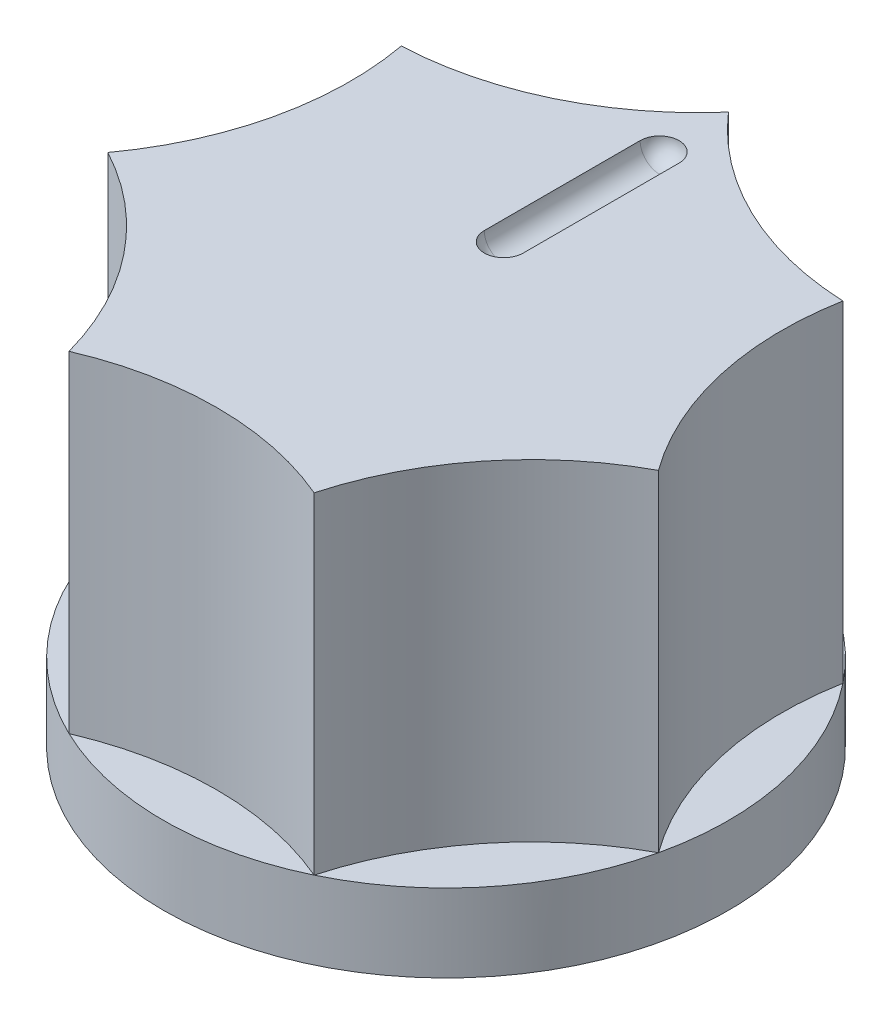
from build123d import *

# Parameters (mm, degrees)
SKETCH1_R           = 7.25
BOSS_EXTRUDE1_DEPTH = 2
BOSS_EXTRUDE2_DEPTH = 8.5
INDICATOR_DEPTH     = 0.5
FILLET1_R           = 0.5
SKETCH4_R           = 3
CUT_EXTRUDE2_DEPTH  = 8
CHAMFER1_SIZE       = 0.5


with BuildPart() as part:
    # Sketch1 → Boss-Extrude1 (new body)
    with BuildSketch(Plane(origin=(0, 0, 0), x_dir=(1, 0, 0), z_dir=(0, 1, 0))):
        with Locations(Location((0, 0, 0), (0, 0, 270))):
            Circle(SKETCH1_R)
    extrude(amount=BOSS_EXTRUDE1_DEPTH)

    # Sketch2 → Boss-Extrude2 (add)
    with BuildSketch(Plane(origin=(0, 2, 0), x_dir=(1, 0, 0), z_dir=(0, 1, 0))):
        with BuildLine():
            ThreePointArc((0, 7.25), (2.553471118, 5.302337412), (5.668278248, 4.520301063))
            ThreePointArc((5.668278248, 4.520301063), (5.737597521, 1.309569193), (7.068227363, -1.613276771))
            ThreePointArc((7.068227363, -1.613276771), (4.601195965, -3.669331339), (3.145657109, -6.532024292))
            ThreePointArc((3.145657109, -6.532024292), (0, -5.885150532), (-3.145657109, -6.532024292))
            ThreePointArc((-3.145657109, -6.532024292), (-4.601195965, -3.669331339), (-7.068227363, -1.613276771))
            ThreePointArc((-7.068227363, -1.613276771), (-5.737597521, 1.309569193), (-5.668278248, 4.520301063))
            ThreePointArc((-5.668278248, 4.520301063), (-2.553471118, 5.302337412), (0, 7.25))
        make_face()
    extrude(amount=BOSS_EXTRUDE2_DEPTH)

    # Sketch3 → Indicator (cut)
    with BuildSketch(Plane(origin=(0, 10.5, 0), x_dir=(1, 0, 0), z_dir=(0, 1, 0))):
        with BuildLine():
            Line((0.5, 5.482775584), (0.5, 1.482775584))
            ThreePointArc((0.5, 1.482775584), (0, 0.982775584), (-0.5, 1.482775584))
            Line((-0.5, 1.482775584), (-0.5, 5.482775584))
            ThreePointArc((-0.5, 5.482775584), (0, 5.982775584), (0.5, 5.482775584))
        make_face()
    extrude(amount=-INDICATOR_DEPTH, mode=Mode.SUBTRACT)

    # Fillet1
    fillet1_edges = [part.edges().sort_by_distance(p)[0] for p in [
        (0.5, 10, -3.482775584),
        (0, 10, -0.982775584),
        (-0.5, 10, -3.482775584),
        (0, 10, -5.982775584),
    ]]
    fillet(fillet1_edges, radius=FILLET1_R - 0.0001)  # a hair under: the kernel refuses the full size

    # Sketch4 → Cut-Extrude2 (cut)
    with BuildSketch(Plane(origin=(0, 0, 0), x_dir=(-1, 0, 0), z_dir=(0, -1, 0))):
        with Locations(Location((0, 0, 0), (0, 0, 90))):
            Circle(SKETCH4_R)
    extrude(amount=-CUT_EXTRUDE2_DEPTH, mode=Mode.SUBTRACT)

    # Chamfer1
    chamfer1_edges = [part.edges().sort_by_distance(p)[0] for p in [
        (0, 0, 3),
    ]]
    chamfer(chamfer1_edges, length=CHAMFER1_SIZE)


solid = part.part
